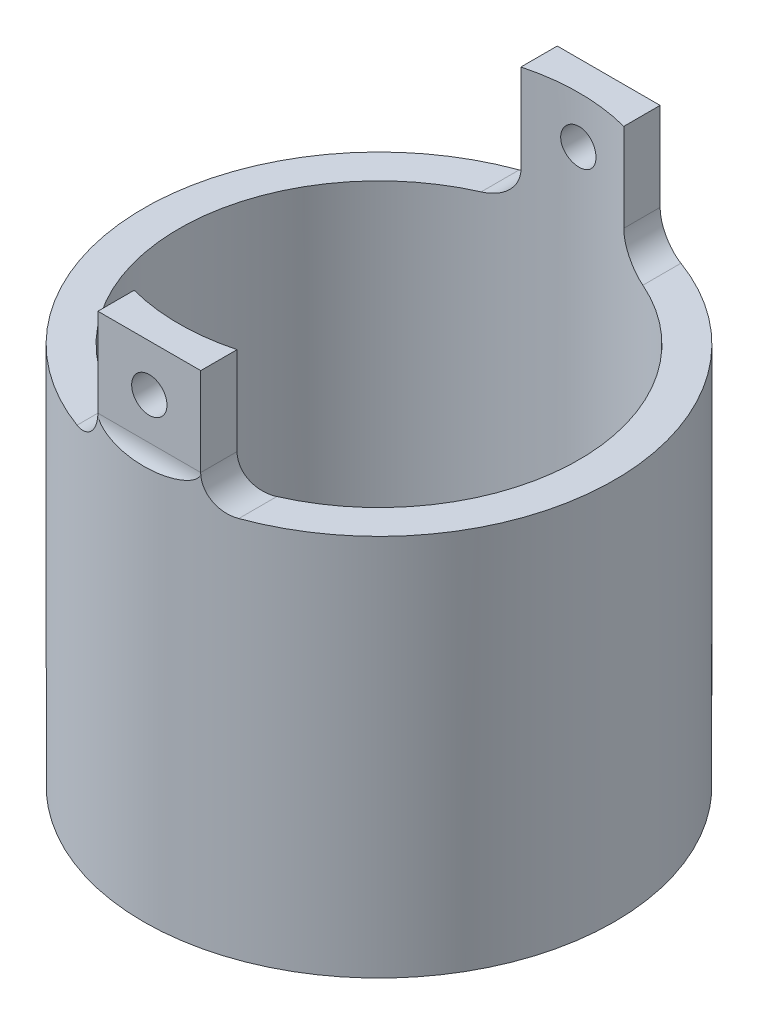
from build123d import *
from build123d.topology import SkipClean

# Parameters (mm, degrees)
SKETCH1_R           = 40
BOSS_EXTRUDE1_DEPTH = 5
SKETCH2_R           = 40
SKETCH2_R_2         = 34
BOSS_EXTRUDE2_DEPTH = 60
BOSS_EXTRUDE3_DEPTH = 20
FILLET1_R           = 5
SKETCH4_R           = 3
CUT_EXTRUDE1_DEPTH  = 95
FILLET2_R           = 5
FILLET3_R           = 5


with BuildPart() as part:
    # Sketch1 → Boss-Extrude1 (new body)
    with BuildSketch(Plane(origin=(0, 0, 0), x_dir=(1, 0, 0), z_dir=(0, 1, 0))):
        with Locations(Location((0, 0, 0), (0, 0, 270))):
            Circle(SKETCH1_R)
    extrude(amount=BOSS_EXTRUDE1_DEPTH)

    # Sketch2 → Boss-Extrude2 (add)
    with BuildSketch(Plane(origin=(0, 5, 0), x_dir=(1, 0, 0), z_dir=(0, 1, 0))):
        with Locations(Location((0, 0, 0), (0, 0, 270))):
            Circle(SKETCH2_R)
        with Locations(Location((0, 0, 0), (0, 0, 270))):
            Circle(SKETCH2_R_2, mode=Mode.SUBTRACT)
    extrude(amount=BOSS_EXTRUDE2_DEPTH)

    # Sketch3 → Boss-Extrude3 (add)
    with SkipClean():  # the faces are left unmerged after this step: merging them gives an invalid solid
        with BuildSketch(Plane(origin=(0, 65, 0), x_dir=(1, 0, 0), z_dir=(0, 1, 0))):
            with BuildLine():
                ThreePointArc((8.738415, -32.857877), (0, -34), (-8.738415, -32.857877))
                Line((-8.738415, -32.857877), (-8.738415, -39.027584))
                Line((-8.738415, -39.027584), (8.738415, -39.027584))
                Line((8.738415, -39.027584), (8.738415, -32.857877))
            make_face()
            with BuildLine():
                Line((8.738415, 39.027584), (-8.738415, 39.027584))
                Line((-8.738415, 39.027584), (-8.738415, 32.857877))
                ThreePointArc((-8.738415, 32.857877), (0, 34), (8.738415, 32.857877))
                Line((8.738415, 32.857877), (8.738415, 39.027584))
            make_face()
        extrude(amount=BOSS_EXTRUDE3_DEPTH)

    # Fillet1
    # the kernel refuses this fillet: 5 mm, written as the material it adds along each edge
    with BuildSketch(Plane(origin=(8.738415, 65, 39.027584), x_dir=(1, 0, 0), z_dir=(0, 0, -1))) as fillet1_piece_1_section:
        with BuildLine():
            CenterArc((FILLET1_R, -FILLET1_R), FILLET1_R, 90, 90)
            Line((0, -FILLET1_R), (0, 0))
            Line((0, 0), (FILLET1_R, 0))
        make_face()
    fillet1_piece_1 = extrude(amount=18.669707, mode=Mode.PRIVATE)
    fillet1_piece_1 = fillet1_piece_1 & Plane(origin=(0, 66.126044, 0), x_dir=(0, 0, 1), z_dir=(0, -1, 0)) * Cylinder(40, 58, mode=Mode.PRIVATE)
    fillet1_piece_1 = fillet1_piece_1 - Plane(origin=(0, 66.126044, 0), x_dir=(0, 0, 1), z_dir=(0, -1, 0)) * Cylinder(34, 58, mode=Mode.PRIVATE)
    add(fillet1_piece_1)
    with BuildSketch(Plane(origin=(-8.738415, 65, 20.357877), x_dir=(-1, 0, 0), z_dir=(0, 0, 1))) as fillet1_piece_2_section:
        with BuildLine():
            CenterArc((FILLET1_R, -FILLET1_R), FILLET1_R, 90, 90)
            Line((0, -FILLET1_R), (0, 0))
            Line((0, 0), (FILLET1_R, 0))
        make_face()
    fillet1_piece_2 = extrude(amount=18.669707, mode=Mode.PRIVATE)
    fillet1_piece_2 = fillet1_piece_2 & Plane(origin=(0, 66.126045, 0), x_dir=(0, 0, 1), z_dir=(0, -1, 0)) * Cylinder(40, 58, mode=Mode.PRIVATE)
    fillet1_piece_2 = fillet1_piece_2 - Plane(origin=(0, 66.126045, 0), x_dir=(0, 0, 1), z_dir=(0, -1, 0)) * Cylinder(34, 58, mode=Mode.PRIVATE)
    add(fillet1_piece_2)
    with BuildSketch(Plane(origin=(-8.738415, 65, -39.027584), x_dir=(-1, 0, 0), z_dir=(0, 0, 1))) as fillet1_piece_3_section:
        with BuildLine():
            CenterArc((FILLET1_R, -FILLET1_R), FILLET1_R, 90, 90)
            Line((0, -FILLET1_R), (0, 0))
            Line((0, 0), (FILLET1_R, 0))
        make_face()
    fillet1_piece_3 = extrude(amount=18.669707, mode=Mode.PRIVATE)
    fillet1_piece_3 = fillet1_piece_3 & Plane(origin=(0, 66.126044, 0), x_dir=(0, 0, 1), z_dir=(0, -1, 0)) * Cylinder(40, 58, mode=Mode.PRIVATE)
    fillet1_piece_3 = fillet1_piece_3 - Plane(origin=(0, 66.126044, 0), x_dir=(0, 0, 1), z_dir=(0, -1, 0)) * Cylinder(34, 58, mode=Mode.PRIVATE)
    add(fillet1_piece_3)
    with BuildSketch(Plane(origin=(8.738415, 65, -20.357877), x_dir=(1, 0, 0), z_dir=(0, 0, -1))) as fillet1_piece_4_section:
        with BuildLine():
            CenterArc((FILLET1_R, -FILLET1_R), FILLET1_R, 90, 90)
            Line((0, -FILLET1_R), (0, 0))
            Line((0, 0), (FILLET1_R, 0))
        make_face()
    fillet1_piece_4 = extrude(amount=18.669707, mode=Mode.PRIVATE)
    fillet1_piece_4 = fillet1_piece_4 & Plane(origin=(0, 66.126045, 0), x_dir=(0, 0, 1), z_dir=(0, -1, 0)) * Cylinder(40, 58, mode=Mode.PRIVATE)
    fillet1_piece_4 = fillet1_piece_4 - Plane(origin=(0, 66.126045, 0), x_dir=(0, 0, 1), z_dir=(0, -1, 0)) * Cylinder(34, 58, mode=Mode.PRIVATE)
    add(fillet1_piece_4)

    # Sketch4 → Cut-Extrude1 (cut)
    with BuildSketch(Plane(origin=(0, 0, -39.027584), x_dir=(-1, 0, 0), z_dir=(0, 0, -1))):
        with Locations((0, 77.048027)):
            Circle(SKETCH4_R)
    extrude(amount=-CUT_EXTRUDE1_DEPTH, mode=Mode.SUBTRACT)

    # Fillet2
    fillet2_edges = [part.edges().sort_by_distance(p)[0] for p in [
        (0, 5, -34),
    ]]
    fillet(fillet2_edges, radius=FILLET2_R)

    # Fillet3
    # the kernel refuses this fillet: 5 mm, written as the material it adds along each edge
    with BuildSketch(Plane(origin=(-8.738415, 65, 39.027584), x_dir=(0, 1, 0), z_dir=(1, 0, 0))) as fillet3_piece_1_section:
        with BuildLine():
            CenterArc((FILLET3_R, FILLET3_R), FILLET3_R, 180, 90)
            Line((0, FILLET3_R), (0, 0))
            Line((0, 0), (FILLET3_R, 0))
        make_face()
    fillet3_piece_1 = extrude(amount=30.004694, mode=Mode.PRIVATE)
    fillet3_piece_1 = fillet3_piece_1 & Plane(origin=(0, 66.676029, 0), x_dir=(0, 0, 1), z_dir=(0, -1, 0)) * Cylinder(40, 81, mode=Mode.PRIVATE)
    fillet3_piece_1 = fillet3_piece_1 - Plane(origin=(13.738415, 70, 39.364377), x_dir=(1, 0, 0), z_dir=(0, 0, 1)) * Cylinder(5, 81, mode=Mode.PRIVATE)
    add(fillet3_piece_1)
    with BuildSketch(Plane(origin=(8.738415, 65, -39.027584), x_dir=(0, 1, 0), z_dir=(-1, 0, 0))) as fillet3_piece_2_section:
        with BuildLine():
            CenterArc((FILLET3_R, FILLET3_R), FILLET3_R, 180, 90)
            Line((0, FILLET3_R), (0, 0))
            Line((0, 0), (FILLET3_R, 0))
        make_face()
    fillet3_piece_2 = extrude(amount=30.004694, mode=Mode.PRIVATE)
    fillet3_piece_2 = fillet3_piece_2 - Plane(origin=(-13.738415, 70, -39.364375), x_dir=(-1, 0, 0), z_dir=(0, 0, -1)) * Cylinder(5, 81, mode=Mode.PRIVATE)
    fillet3_piece_2 = fillet3_piece_2 & Plane(origin=(0, 66.676016, 0), x_dir=(0, 0, 1), z_dir=(0, -1, 0)) * Cylinder(40, 81, mode=Mode.PRIVATE)
    add(fillet3_piece_2)
    with BuildSketch(Plane(origin=(8.738415, 65, -39.027584), x_dir=(0, 0, -1), z_dir=(1, 0, 0))) as fillet3_piece_3_section:
        with BuildLine():
            CenterArc((FILLET3_R, FILLET3_R), FILLET3_R, 180, 90)
            Line((0, FILLET3_R), (0, 0))
            Line((0, 0), (FILLET3_R, 0))
        make_face()
    fillet3_piece_3 = extrude(amount=12.527864, mode=Mode.PRIVATE)
    fillet3_piece_3 = fillet3_piece_3 & Plane(origin=(0, 67.353955, 0), x_dir=(0, 0, 1), z_dir=(0, -1, 0)) * Cylinder(40, 46, mode=Mode.PRIVATE)
    fillet3_piece_3 = fillet3_piece_3 - Plane(origin=(13.738415, 70, -39.02968), x_dir=(1, 0, 0), z_dir=(0, 0, 1)) * Cylinder(5, 46, mode=Mode.PRIVATE)
    add(fillet3_piece_3)
    with BuildSketch(Plane(origin=(-8.738415, 65, 39.027584), x_dir=(0, 1, 0), z_dir=(-1, 0, 0))) as fillet3_piece_4_section:
        with BuildLine():
            CenterArc((FILLET3_R, -FILLET3_R), FILLET3_R, 90, 90)
            Line((0, -FILLET3_R), (0, 0))
            Line((0, 0), (FILLET3_R, 0))
        make_face()
    fillet3_piece_4 = extrude(amount=12.527864, mode=Mode.PRIVATE)
    fillet3_piece_4 = fillet3_piece_4 - Plane(origin=(-13.738415, 70, 39.02968), x_dir=(-1, 0, 0), z_dir=(0, 0, -1)) * Cylinder(5, 46, mode=Mode.PRIVATE)
    fillet3_piece_4 = fillet3_piece_4 & Plane(origin=(0, 67.353955, 0), x_dir=(0, 0, 1), z_dir=(0, -1, 0)) * Cylinder(40, 46, mode=Mode.PRIVATE)
    add(fillet3_piece_4)


solid = part.part
